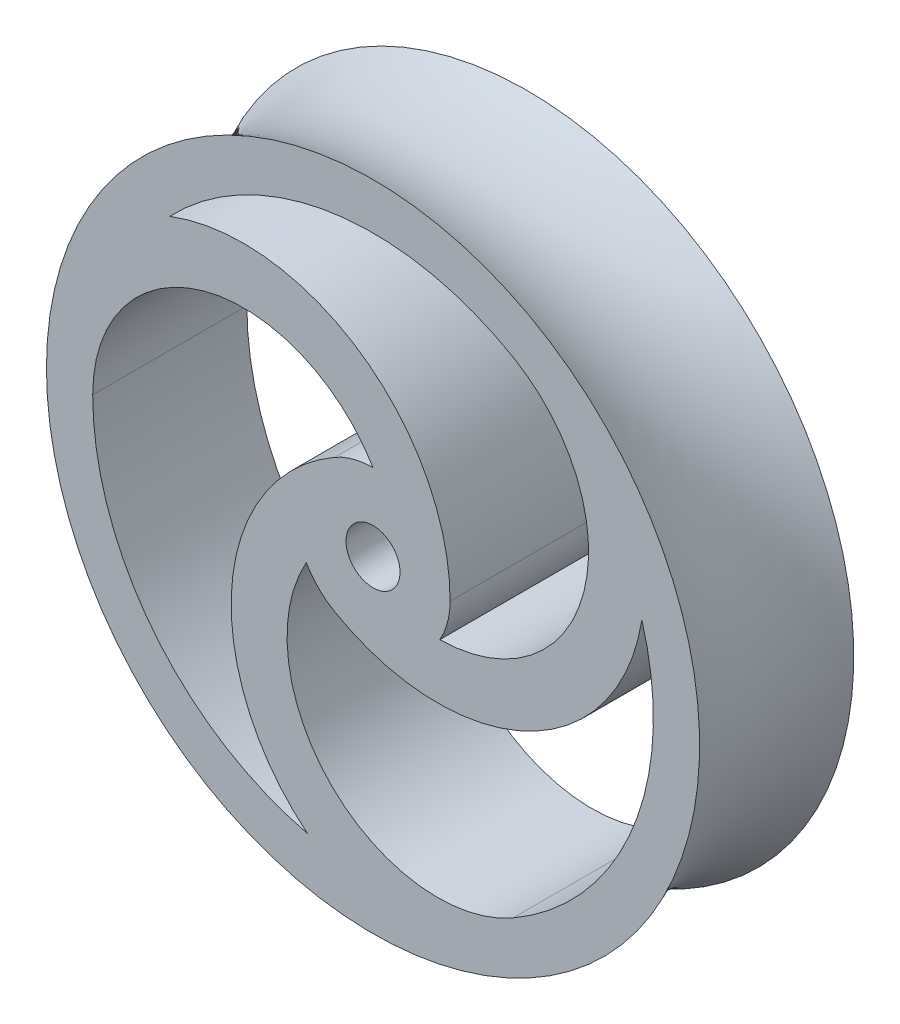
from build123d import *

# Parameters (mm, degrees)
SKETCH3_R          = 1.75
CUT_EXTRUDE1_DEPTH = 32.583508329


with BuildPart() as part:
    # Sketch2 → Revolve1 (revolve)
    with BuildSketch(Plane(origin=(0, 0, 0), x_dir=(1, 0, 0), z_dir=(0, 1, 0))):
        with BuildLine():
            Line((0, 5), (0, -5))
            Line((0, -5), (21.183932571, -5))
            ThreePointArc((21.183932571, -5), (20, 0), (21.183932571, 5))
            Line((21.183932571, 5), (0, 5))
        make_face()
    revolve(axis=Axis((0, 0, -5), (0, 0, 1)))

    # Sketch3 → Cut-Extrude1 (cut, through all)
    with BuildSketch(Plane(origin=(0, 0, -5), x_dir=(-1, 0, 0), z_dir=(0, 0, -1))):
        Circle(SKETCH3_R)
        with BuildLine():
            ThreePointArc((0, 5), (10.997333595, 9.429414135), (18.183932571, 0))
            ThreePointArc((18.183932571, 0), (14.282948757, -11.254011665), (4.25374689, -17.67939595))
            ThreePointArc((4.25374689, -17.67939595), (9.159921238, -6.213833834), (2.5, 4.330127019))
            ThreePointArc((2.5, 4.330127019), (1.294095226, 4.829629131), (0, 5))
        make_face()
        with BuildLine():
            ThreePointArc((4.330127019, -2.5), (3.535533906, -3.535533906), (2.5, -4.330127019))
            ThreePointArc((2.5, -4.330127019), (-9.961298574, -4.825807572), (-17.437679461, 5.155845107))
            ThreePointArc((-17.437679461, 5.155845107), (-16.887734375, -6.742390631), (-9.091966285, -15.747747547))
            ThreePointArc((-9.091966285, -15.747747547), (2.667445387, -14.238677335), (4.330127019, -2.5))
        make_face()
        with BuildLine():
            ThreePointArc((-4.330127019, -2.5), (-4.829629131, -1.294095226), (-5, 0))
            ThreePointArc((-5, 0), (0.801377336, 11.039641406), (13.183932571, 12.523550843))
            ThreePointArc((13.183932571, 12.523550843), (2.604785618, 17.996402297), (-9.091966285, 15.747747547))
            ThreePointArc((-9.091966285, 15.747747547), (-13.664778981, 4.809263199), (-4.330127019, -2.5))
        make_face()
    extrude(amount=-CUT_EXTRUDE1_DEPTH, mode=Mode.SUBTRACT)


solid = part.part
